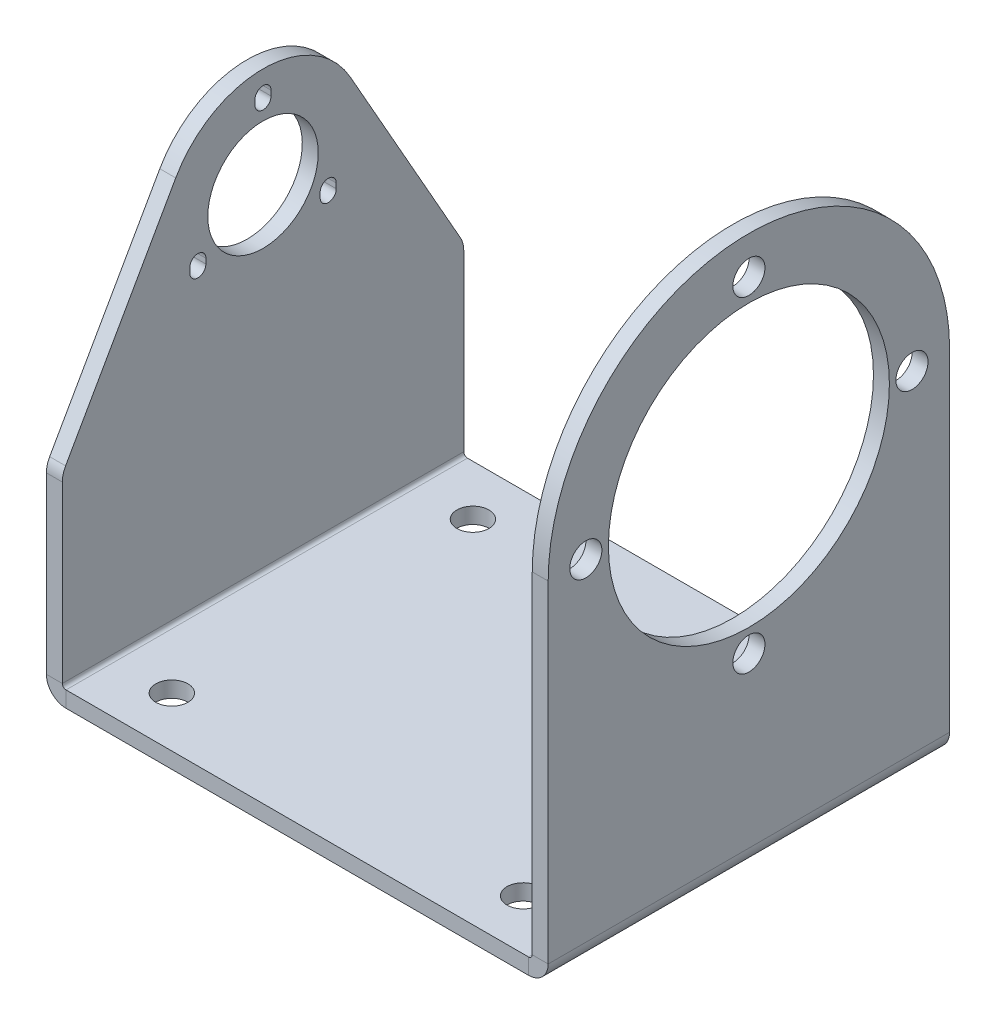
from build123d import *

# Parameters (mm, degrees)
SKETCH1_W                      = 80
SKETCH1_H                      = 100
BASE_FLANGE1_DEPTH             = 3.175
EDGE_FLANGE2_STRIP_W           = 14.1732
EDGE_FLANGE2_STRIP_H           = 3.175
EDGE_FLANGE2_STRIP_CUT_DEPTH   = 80
EDGE_FLANGE2_STRIP_2_W         = 14.1732
EDGE_FLANGE2_STRIP_2_H         = 3.175
EDGE_FLANGE2_STRIP_CUT_2_DEPTH = 80
EDGE_FLANGE2_DEPTH             = 80
EDGE_FLANGE2_BEND_DEPTH        = 80
CUT_EXTRUDE1_REACH             = 155.948
SKETCH12_R                     = 28
M6_CLEARANCE_HOLE1_D           = 6.4
M6_CLEARANCE_HOLE1_DEPTH       = 3.175
M6_CLEARANCE_HOLE2_D           = 6.4
CUT_EXTRUDE2_REACH             = 155.948
SKETCH19_R                     = 11
FILLET1_R                      = 5


# Sheet-metal steps are written as plain solids
with BuildPart() as part:
    # Sketch1 → Base-Flange1 (new body)
    with BuildSketch(Plane(origin=(0, 0, 0), x_dir=(0, 0, -1), z_dir=(0, -1, 0))):
        Rectangle(SKETCH1_W, SKETCH1_H)
    extrude(amount=-BASE_FLANGE1_DEPTH)

    # Edge-Flange2 strip (across the edge) → Edge-Flange2 strip cut (cut)
    with BuildSketch(Plane(origin=(50, 3.175, 40), x_dir=(-1, 0, 0), z_dir=(0, 0, -1))):
        with Locations((-3.175, -1.5875)):
            Rectangle(EDGE_FLANGE2_STRIP_W, EDGE_FLANGE2_STRIP_H)
    extrude(amount=EDGE_FLANGE2_STRIP_CUT_DEPTH, mode=Mode.SUBTRACT)

    # Edge-Flange2 strip 2 (across the edge) → Edge-Flange2 strip cut 2 (cut)
    with BuildSketch(Plane(origin=(-50, 3.175, -40), x_dir=(1, 0, 0), z_dir=(0, 0, 1))):
        with Locations((-3.175, -1.5875)):
            Rectangle(EDGE_FLANGE2_STRIP_2_W, EDGE_FLANGE2_STRIP_2_H)
    extrude(amount=EDGE_FLANGE2_STRIP_CUT_2_DEPTH, mode=Mode.SUBTRACT)

    # Edge-Flange2 section (across the edge) → Edge-Flange2 (add)
    with BuildSketch(Plane(origin=(50, 3.175, 40), x_dir=(-1, 0, 0), z_dir=(0, 0, -1))):
        with BuildLine():
            Line((0, 0.7366), (0, 106.825))
            Line((0, 106.825), (3.175, 106.825))
            Line((3.175, 106.825), (3.175, 0.7366))
            ThreePointArc((3.175, 0.7366), (3.390745145, 0.215745145), (3.9116, 0))
            Line((3.9116, 0), (3.9116, -3.175))
            ThreePointArc((3.9116, -3.175), (1.145681115, -2.029318885), (0, 0.7366))
        make_face()
    extrude(amount=EDGE_FLANGE2_DEPTH)

    # Edge-Flange2 section 2 (across the edge) → Edge-Flange2 bend (add)
    with BuildSketch(Plane(origin=(-50, 3.175, -40), x_dir=(1, 0, 0), z_dir=(0, 0, 1))):
        with BuildLine():
            Line((0, 0.7366), (0, 106.825))
            Line((0, 106.825), (3.175, 106.825))
            Line((3.175, 106.825), (3.175, 0.7366))
            ThreePointArc((3.175, 0.7366), (3.390745145, 0.215745145), (3.9116, 0))
            Line((3.9116, 0), (3.9116, -3.175))
            ThreePointArc((3.9116, -3.175), (1.145681115, -2.029318885), (0, 0.7366))
        make_face()
    extrude(amount=EDGE_FLANGE2_BEND_DEPTH)

    # Sketch12 → Cut-Extrude1 (cut, up to next)
    with BuildSketch(Plane(origin=(50, 0, 0), x_dir=(0, 0, -1), z_dir=(1, 0, 0)), mode=Mode.PRIVATE) as cut_extrude1_sk1:
        with BuildLine():
            Line((-40, 110), (-40, 70))
            ThreePointArc((-40, 70), (-28.284271269, 98.284271226), (-6.1e-08, 110))
            Line((-6.1e-08, 110), (-40, 110))
        make_face()
    cut_extrude1_tool1 = extrude(cut_extrude1_sk1.sketch, amount=-CUT_EXTRUDE1_REACH, mode=Mode.PRIVATE) & part.part
    # Sketch12 → Cut-Extrude1 (cut, up to next)
    with BuildSketch(Plane(origin=(50, 0, 0), x_dir=(0, 0, -1), z_dir=(1, 0, 0)), mode=Mode.PRIVATE) as cut_extrude1_sk2:
        with BuildLine():
            Line((40, 110), (-6.1e-08, 110))
            ThreePointArc((-6.1e-08, 110), (28.284271226, 98.284271269), (40, 70))
            Line((40, 70), (40, 110))
        make_face()
    cut_extrude1_tool2 = extrude(cut_extrude1_sk2.sketch, amount=-CUT_EXTRUDE1_REACH, mode=Mode.PRIVATE) & part.part
    # Sketch12 → Cut-Extrude1 (cut, up to next)
    with BuildSketch(Plane(origin=(50, 0, 0), x_dir=(0, 0, -1), z_dir=(1, 0, 0)), mode=Mode.PRIVATE) as cut_extrude1_sk3:
        with Locations(Location((0, 70, 0), (0, 0, 90))):
            Circle(SKETCH12_R)
    cut_extrude1_tool3 = extrude(cut_extrude1_sk3.sketch, amount=-CUT_EXTRUDE1_REACH, mode=Mode.PRIVATE) & part.part
    add(cut_extrude1_tool1.solids().sort_by_distance((50, 101.065282, 31.065282))[0], mode=Mode.SUBTRACT)
    add(cut_extrude1_tool2.solids().sort_by_distance((50, 101.065282, -31.065282))[0], mode=Mode.SUBTRACT)
    add(cut_extrude1_tool3.solids().sort_by_distance((50, 70, 0))[0], mode=Mode.SUBTRACT)

    # M6 Clearance Hole1
    with Locations(Plane(origin=(50, 70, 32.5), x_dir=(0, 1, 0), z_dir=(1, 0, 0))):
        with Locations((0, 0), (-32.5, -32.5), (0, -65), (32.5, -32.5)):
            Hole(M6_CLEARANCE_HOLE1_D / 2, depth=M6_CLEARANCE_HOLE1_DEPTH)

    # M6 Clearance Hole2 (through all)
    with Locations(Plane(origin=(-35, 0, 30), x_dir=(0, 0, -1), z_dir=(0, -1, 0))):
        with Locations((0, 0), (0, 70), (60, 0), (60, 70)):
            Hole(M6_CLEARANCE_HOLE2_D / 2)

    # Sketch19 → Cut-Extrude2 (cut, up to next)
    with BuildSketch(Plane.ZY.offset(50), mode=Mode.PRIVATE) as cut_extrude2_sk1:
        with BuildLine():
            Line((-40, 40), (-17.398181668, 79.864242224))
            ThreePointArc((-17.398181668, 79.864242224), (0, 90), (17.398181668, 79.864242224))
            Line((17.398181668, 79.864242224), (40, 40))
            Line((40, 40), (40, 110))
            Line((40, 110), (-40, 110))
            Line((-40, 110), (-40, 40))
        make_face()
    cut_extrude2_tool1 = extrude(cut_extrude2_sk1.sketch, amount=-CUT_EXTRUDE2_REACH, mode=Mode.PRIVATE) & part.part
    # Sketch19 → Cut-Extrude2 (cut, up to next)
    with BuildSketch(Plane.ZY.offset(50), mode=Mode.PRIVATE) as cut_extrude2_sk2:
        with Locations(Location((0, 70, 0), (0, 0, 270))):
            Circle(SKETCH19_R)
    cut_extrude2_tool2 = extrude(cut_extrude2_sk2.sketch, amount=-CUT_EXTRUDE2_REACH, mode=Mode.PRIVATE) & part.part
    # Sketch19 → Cut-Extrude2 (cut, up to next)
    with BuildSketch(Plane.ZY.offset(50), mode=Mode.PRIVATE) as cut_extrude2_sk3:
        with BuildLine():
            ThreePointArc((-11.390381057, 62), (-12.990381057, 60.4), (-14.590381057, 62))
            Line((-14.590381057, 62), (-14.590381057, 63))
            ThreePointArc((-14.590381057, 63), (-12.990381057, 64.6), (-11.390381057, 63))
            Line((-11.390381057, 63), (-11.390381057, 62))
        make_face()
    cut_extrude2_tool3 = extrude(cut_extrude2_sk3.sketch, amount=-CUT_EXTRUDE2_REACH, mode=Mode.PRIVATE) & part.part
    # Sketch19 → Cut-Extrude2 (cut, up to next)
    with BuildSketch(Plane.ZY.offset(50), mode=Mode.PRIVATE) as cut_extrude2_sk4:
        with BuildLine():
            ThreePointArc((14.590381057, 62), (12.990381057, 60.4), (11.390381057, 62))
            Line((11.390381057, 62), (11.390381057, 63))
            ThreePointArc((11.390381057, 63), (12.990381057, 64.6), (14.590381057, 63))
            Line((14.590381057, 63), (14.590381057, 62))
        make_face()
    cut_extrude2_tool4 = extrude(cut_extrude2_sk4.sketch, amount=-CUT_EXTRUDE2_REACH, mode=Mode.PRIVATE) & part.part
    # Sketch19 → Cut-Extrude2 (cut, up to next)
    with BuildSketch(Plane.ZY.offset(50), mode=Mode.PRIVATE) as cut_extrude2_sk5:
        with BuildLine():
            ThreePointArc((1.6, 84.5), (0, 82.9), (-1.6, 84.5))
            Line((-1.6, 84.5), (-1.6, 85.5))
            ThreePointArc((-1.6, 85.5), (0, 87.1), (1.6, 85.5))
            Line((1.6, 85.5), (1.6, 84.5))
        make_face()
    cut_extrude2_tool5 = extrude(cut_extrude2_sk5.sketch, amount=-CUT_EXTRUDE2_REACH, mode=Mode.PRIVATE) & part.part
    add(cut_extrude2_tool1.solids().sort_by_distance((-50, 60.456413, -29.623817))[0], mode=Mode.SUBTRACT)
    add(cut_extrude2_tool2.solids().sort_by_distance((-50, 70, 0))[0], mode=Mode.SUBTRACT)
    add(cut_extrude2_tool3.solids().sort_by_distance((-50, 62.5, -12.990381))[0], mode=Mode.SUBTRACT)
    add(cut_extrude2_tool4.solids().sort_by_distance((-50, 62.5, 12.990381))[0], mode=Mode.SUBTRACT)
    add(cut_extrude2_tool5.solids().sort_by_distance((-50, 85, 0))[0], mode=Mode.SUBTRACT)

    # Fillet1
    fillet1_edges = [part.edges().sort_by_distance(p)[0] for p in [
        (-48.4125, 40, 40),
        (-48.4125, 40, -40),
    ]]
    fillet(fillet1_edges, radius=FILLET1_R)


solid = part.part
